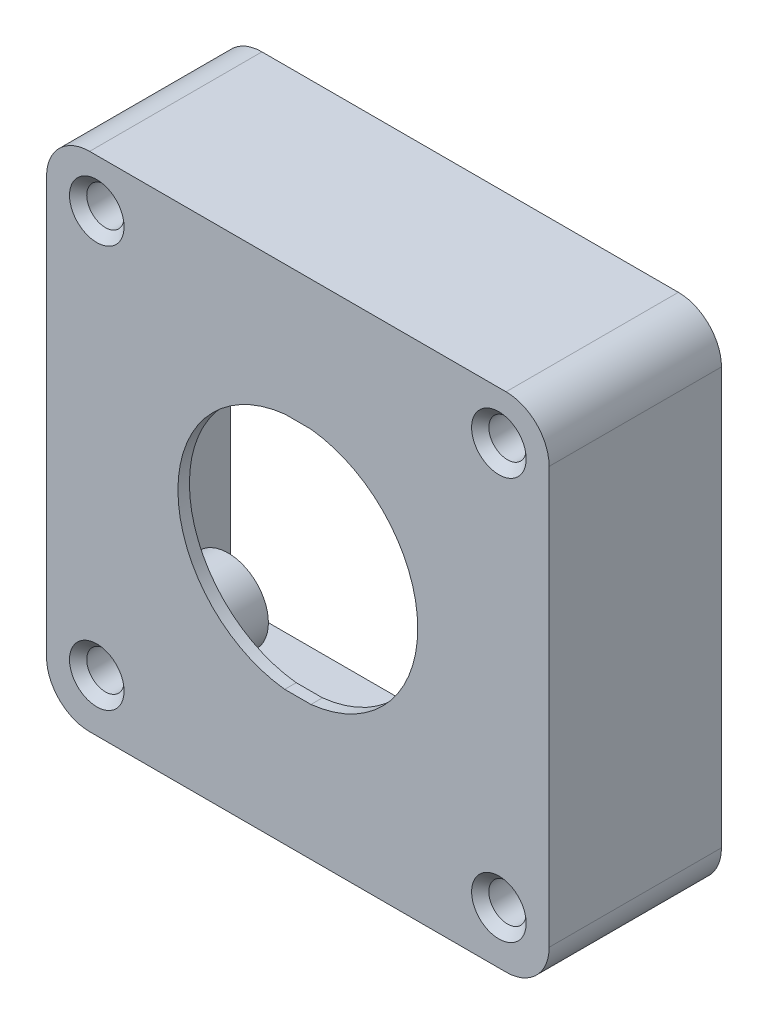
from build123d import *
from build123d.topology import SkipClean

# Parameters (mm, degrees)
CROQUIS2_W              = 35
CROQUIS2_H              = 35
SALIENTE_EXTRUIR1_DEPTH = 12
REDONDEO1_R             = 3
VACIADO1_T              = -0.8
CORTAR_EXTRUIR3_DEPTH   = 28.504545079
CROQUIS6_R              = 1.3
CORTAR_EXTRUIR4_DEPTH   = 28.504545079
CHAFL_N3_SIZE           = 0.6
CROQUIS7_R              = 2.8
CROQUIS7_R_2            = 1.3
SALIENTE_EXTRUIR2_DEPTH = 8.35


with BuildPart() as part:
    # Croquis2 → Saliente-Extruir1 (new body)
    with BuildSketch(Plane.XY):
        Rectangle(CROQUIS2_W, CROQUIS2_H)
    extrude(amount=SALIENTE_EXTRUIR1_DEPTH)

    # Redondeo1
    redondeo1_edges = [part.edges().sort_by_distance(p)[0] for p in [
        (-17.5, 17.5, 6),
        (-17.5, -17.5, 6),
        (17.5, -17.5, 6),
        (17.5, 17.5, 6),
    ]]
    fillet(redondeo1_edges, radius=REDONDEO1_R)

    # Vaciado1
    vaciado1_openings = [part.faces().sort_by_distance(p)[0] for p in [
        (0, 0, 0),
    ]]
    offset(amount=VACIADO1_T, openings=vaciado1_openings, kind=Kind.INTERSECTION)

    # Croquis5 → Cortar-Extruir3 (cut, through all)
    with BuildSketch(Plane.XY.offset(12)):
        with BuildLine():
            Line((-0.91241438, 8.45), (0.91241438, 8.45))
            ThreePointArc((0.91241438, 8.45), (8.35, 0.15), (0.91241438, -8.15))
            Line((0.91241438, -8.15), (-0.91241438, -8.15))
            ThreePointArc((-0.91241438, -8.15), (-8.35, 0.15), (-0.91241438, 8.45))
        make_face()
    extrude(amount=-CORTAR_EXTRUIR3_DEPTH, mode=Mode.SUBTRACT)

    # Croquis6 → Cortar-Extruir4 (cut, through all)
    with BuildSketch(Plane.XY.offset(12)):
        with Locations((-14, 14.15)):
            Circle(CROQUIS6_R)
        with Locations((14, 14.15)):
            Circle(CROQUIS6_R)
        with Locations((14, -13.85)):
            Circle(CROQUIS6_R)
        with Locations((-14, -13.85)):
            Circle(CROQUIS6_R)
    extrude(amount=-CORTAR_EXTRUIR4_DEPTH, mode=Mode.SUBTRACT)

    # Chaflán3
    chafl_n3_edges = [part.edges().sort_by_distance(p)[0] for p in [
        (-15.3, -13.85, 12),
        (12.7, -13.85, 12),
        (12.7, 14.15, 12),
        (-15.3, 14.15, 12),
    ]]
    chamfer(chafl_n3_edges, length=CHAFL_N3_SIZE)

    # Croquis7 → Saliente-Extruir2 (add)
    # profile 1 of 4: a face of its own
    with SkipClean():  # the faces are left unmerged after this step: merging them gives an invalid solid
        with BuildSketch(Plane(origin=(0, 0, 11.2), x_dir=(-1, 0, 0), z_dir=(0, 0, -1))):
            with Locations((-14, 14.15)):
                Circle(CROQUIS7_R)
            with Locations((-14, 14.15)):
                Circle(CROQUIS7_R_2, mode=Mode.SUBTRACT)
        # profile 2 of 4: a face of its own
        with BuildSketch(Plane(origin=(0, 0, 11.2), x_dir=(-1, 0, 0), z_dir=(0, 0, -1))):
            with Locations((14, 14.15)):
                Circle(CROQUIS7_R)
            with Locations((14, 14.15)):
                Circle(CROQUIS7_R_2, mode=Mode.SUBTRACT)
        # profile 3 of 4: a face of its own
        with BuildSketch(Plane(origin=(0, 0, 11.2), x_dir=(-1, 0, 0), z_dir=(0, 0, -1))):
            with Locations((14, -13.85)):
                Circle(CROQUIS7_R)
            with Locations((14, -13.85)):
                Circle(CROQUIS7_R_2, mode=Mode.SUBTRACT)
        # profile 4 of 4: a face of its own
        with BuildSketch(Plane(origin=(0, 0, 11.2), x_dir=(-1, 0, 0), z_dir=(0, 0, -1))):
            with Locations((-14, -13.85)):
                Circle(CROQUIS7_R)
            with Locations((-14, -13.85)):
                Circle(CROQUIS7_R_2, mode=Mode.SUBTRACT)
        extrude(amount=SALIENTE_EXTRUIR2_DEPTH)


solid = part.part
